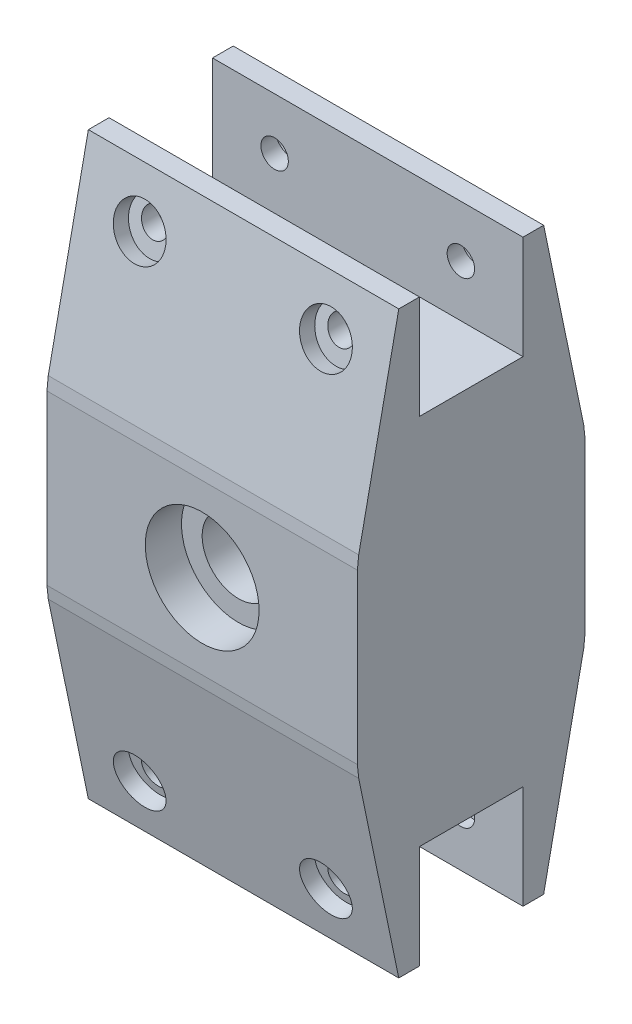
from build123d import *

# Parameters (mm, degrees)
EXTRUIR_L_MINA1_START   = -30
EXTRUIR_L_MINA1_DEPTH   = 60
CROQUIS2_W              = 29.989677058
CROQUIS2_H              = 58.075247638
SALIENTE_EXTRUIR1_DEPTH = 30
CROQUIS3_R              = 7
CORTAR_EXTRUIR1_DEPTH   = 60
CROQUIS4_R              = 11
CORTAR_EXTRUIR2_DEPTH   = 7
CORTAR_EXTRUIR3_START   = -7
CROQUIS5_R              = 11
CORTAR_EXTRUIR3_DEPTH   = 7
CROQUIS7_R              = 2.65
CORTAR_EXTRUIR4_DEPTH   = 30
CROQUIS8_R              = 5
CORTAR_EXTRUIR5_DEPTH   = 3
CROQUIS9_R              = 5
CORTAR_EXTRUIR6_DEPTH   = 3
CROQUIS10_R             = 5
CORTAR_EXTRUIR7_DEPTH   = 3
CROQUIS11_R             = 5
CORTAR_EXTRUIR8_DEPTH   = 3


# Read off the part's stored shape, not the designer's step: Extruir-Lámina1
with BuildPart() as part:
    # Extruir-Lámina1 outline → Extruir-Lámina1 (new body)
    with BuildSketch(Plane(origin=(0, 0, 0), x_dir=(0, 0, -1), z_dir=(1, 0, 0)).offset(EXTRUIR_L_MINA1_START)):
        Polygon((10.020236328, -26.000123541), (0.000367551, -26.000123541), (0.000367551, -36.000123541), (10.000367551, -36.000123541), (10.000367551, -56.000123541), (14.000367551, -56.000123541), (21.74906786, -18.707636838), (22, -16.2665), (22, 16.2665), (21.74906786, 18.707636838), (14.000367551, 56.000123541), (10.000367551, 56.000123541), (10.000367551, 36.000123541), (-10.000367551, 36.000123541), (-10.000367551, 56.000123541), (-14.000367551, 56.000123541), (-21.74906786, 18.707636838), (-22, 16.2665), (-22, -16.2665), (-21.74906786, -18.707636838), (-14.000367551, -56.000123541), (-10.000367551, -56.000123541), (-10.000367551, -36.000123541), (-0.000367551, -36.000123541), (-0.000367551, -26.000123541), (-10.020236328, -26.000123541), (-11.853902107, -17.175165292), (-12, -15.753884831), (-12, 15.753884831), (-11.853902107, 17.175165292), (-10.020236328, 26.000123541), (10.020236328, 26.000123541), (11.853902107, 17.175165292), (12, 15.753884831), (12, -15.753884831), (11.853902107, -17.175165292), align=None)
    extrude(amount=EXTRUIR_L_MINA1_DEPTH)

    # Croquis2 → Saliente-Extruir1 (add, symmetric)
    with BuildSketch(Plane(origin=(0, 0, 0), x_dir=(0, 0, -1), z_dir=(1, 0, 0))):
        Rectangle(CROQUIS2_W, CROQUIS2_H)
    extrude(amount=SALIENTE_EXTRUIR1_DEPTH, both=True)

    # Croquis3 → Cortar-Extruir1 (cut)
    with BuildSketch(Plane.XY.offset(22)):
        Circle(CROQUIS3_R)
    extrude(amount=-CORTAR_EXTRUIR1_DEPTH, mode=Mode.SUBTRACT)

    # Croquis4 → Cortar-Extruir2 (cut)
    with BuildSketch(Plane.XY.offset(22)):
        Circle(CROQUIS4_R)
    extrude(amount=-CORTAR_EXTRUIR2_DEPTH, mode=Mode.SUBTRACT)

    # Croquis5 → Cortar-Extruir3 (cut)
    with BuildSketch(Plane(origin=(0, 0, -22), x_dir=(-1, 0, 0), z_dir=(0, 0, -1)).offset(CORTAR_EXTRUIR3_START)):
        with Locations(Location((0, 0, 0), (0, 0, 180))):
            Circle(CROQUIS5_R)
    extrude(amount=CORTAR_EXTRUIR3_DEPTH, mode=Mode.SUBTRACT)

    # Croquis7 → Cortar-Extruir4 (cut, symmetric)
    with BuildSketch(Plane.XY):
        with Locations(Location((-18, 46.000123541, 0), (0, 0, 270))):
            Circle(CROQUIS7_R)
        with Locations(Location((18, 46.000123541, 0), (0, 0, 270))):
            Circle(CROQUIS7_R)
        with Locations(Location((-18, -46.000123541, 0), (0, 0, 90))):
            Circle(CROQUIS7_R)
        with Locations(Location((18, -46.000123541, 0), (0, 0, 90))):
            Circle(CROQUIS7_R)
    extrude(amount=CORTAR_EXTRUIR4_DEPTH, both=True, mode=Mode.SUBTRACT)

    # Croquis8 → Cortar-Extruir5 (cut)
    with BuildSketch(Plane(origin=(0, 5.106275996, 24.575183206), x_dir=(1, 0, 0), z_dir=(0, 0.20343669587104055, 0.979088101640028))):
        with Locations(Location((-18, 41.767280673, 0), (0, 0, 270))):
            Circle(CROQUIS8_R)
        with Locations(Location((18, 41.767280673, 0), (0, 0, 270))):
            Circle(CROQUIS8_R)
    extrude(amount=-CORTAR_EXTRUIR5_DEPTH, mode=Mode.SUBTRACT)

    # Croquis9 → Cortar-Extruir6 (cut)
    with BuildSketch(Plane(origin=(0, -5.106275996, 24.575183206), x_dir=(1, 0, 0), z_dir=(0, -0.2034366958710477, 0.9790881016400266))):
        with Locations(Location((-18, -41.767280673, 0), (0, 0, 270))):
            Circle(CROQUIS9_R)
        with Locations(Location((18, -41.767280673, 0), (0, 0, 270))):
            Circle(CROQUIS9_R)
    extrude(amount=-CORTAR_EXTRUIR6_DEPTH, mode=Mode.SUBTRACT)

    # Croquis10 → Cortar-Extruir7 (cut)
    with BuildSketch(Plane(origin=(0, 5.106275996, -24.575183206), x_dir=(-1, 0, 0), z_dir=(0, 0.2034366958710399, -0.9790881016400281))):
        with Locations(Location((-18, 41.767280673, 0), (0, 0, 90))):
            Circle(CROQUIS10_R)
        with Locations(Location((18, 41.767280673, 0), (0, 0, 90))):
            Circle(CROQUIS10_R)
    extrude(amount=-CORTAR_EXTRUIR7_DEPTH, mode=Mode.SUBTRACT)

    # Croquis11 → Cortar-Extruir8 (cut)
    with BuildSketch(Plane(origin=(0, -5.106275996, -24.575183206), x_dir=(-1, 0, 0), z_dir=(0, -0.20343669587104735, -0.9790881016400267))):
        with Locations(Location((-18, -41.767280673, 0), (0, 0, 90))):
            Circle(CROQUIS11_R)
        with Locations(Location((18, -41.767280673, 0), (0, 0, 90))):
            Circle(CROQUIS11_R)
    extrude(amount=-CORTAR_EXTRUIR8_DEPTH, mode=Mode.SUBTRACT)


solid = part.part
